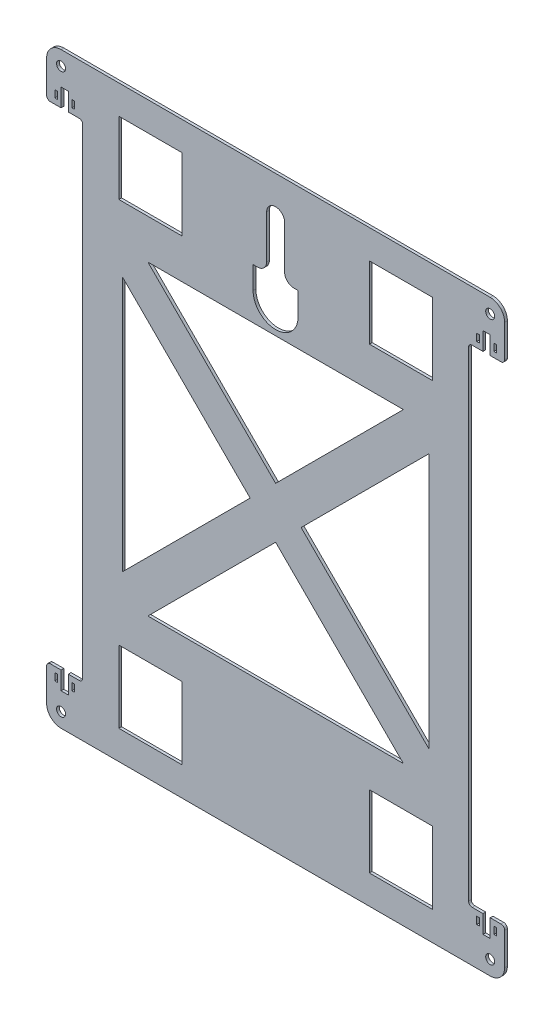
from build123d import *

# Parameters (mm, degrees)
SKETCH1_W          = 254
SKETCH1_H          = 326
BASE_FLANGE1_DEPTH = 1.51892
SKETCH6_R          = 2.5
SKETCH6_W          = 1.5
SKETCH6_H          = 4
SKETCH6_W_2        = 35
SKETCH6_H_2        = 40
CUT_EXTRUDE1_DEPTH = 10
CUT_EXTRUDE2_DEPTH = 10


# Sheet-metal steps are written as plain solids
with BuildPart() as part:
    # Sketch1 → Base-Flange1 (new body)
    with BuildSketch(Plane.XY):
        Rectangle(SKETCH1_W, SKETCH1_H)
    extrude(amount=BASE_FLANGE1_DEPTH)

    # Sketch6 → Cut-Extrude1 (cut)
    with BuildSketch(Plane(origin=(0, 0, 0), x_dir=(-1, 0, 0), z_dir=(0, 0, -1))):
        with BuildLine():
            ThreePointArc((-124.99999998, 135), (-126.414213542, 135.585786438), (-126.99999998, 137))
            Line((-127, 137), (-127, -137))
            ThreePointArc((-126.99999998, -137), (-126.414213542, -135.585786438), (-124.99999998, -135))
            Line((-124.99999998, -135), (-119, -135))
            Line((-119, -135), (-119, -145))
            Line((-119, -145), (-115, -145))
            Line((-115, -145), (-115, -135))
            Line((-115, -135), (-109, -135))
            ThreePointArc((-109, -135), (-107.585786438, -134.414213562), (-107, -133))
            Line((-107, -133), (-107, 133))
            ThreePointArc((-107, 133), (-107.585786438, 134.414213562), (-109, 135))
            Line((-109, 135), (-115, 135))
            Line((-115, 135), (-115, 145))
            Line((-115, 145), (-119, 145))
            Line((-119, 145), (-119, 135))
            Line((-119, 135), (-124.99999998, 135))
        make_face()
        with Locations((-119, 155)):
            Circle(SKETCH6_R)
        with BuildLine():
            ThreePointArc((-126.99999998, 155), (-124.656854247, 160.656854252), (-119, 163))
            Line((-119, 163), (-127, 163))
            Line((-127, 163), (-127, 155))
        make_face()
        with Locations((-121.75, 140)):
            Rectangle(SKETCH6_W, SKETCH6_H)
        with Locations((-112.25, 140)):
            Rectangle(SKETCH6_W, SKETCH6_H)
        with Locations((-69.5, 127)):
            Rectangle(SKETCH6_W_2, SKETCH6_H_2)
        with BuildLine():
            Line((127, -137), (127, 137))
            ThreePointArc((127, 137), (126.414213562, 135.585786438), (125, 135))
            Line((125, 135), (119, 135))
            Line((119, 135), (119, 145))
            Line((119, 145), (115, 145))
            Line((115, 145), (115, 135))
            Line((115, 135), (109, 135))
            ThreePointArc((109, 135), (107.585786438, 134.414213562), (107, 133))
            Line((107, 133), (107, -133))
            ThreePointArc((107, -133), (107.585786438, -134.414213562), (109, -135))
            Line((109, -135), (115, -135))
            Line((115, -135), (115, -145))
            Line((115, -145), (119, -145))
            Line((119, -145), (119, -135))
            Line((119, -135), (125, -135))
            ThreePointArc((125, -135), (126.414213562, -135.585786438), (127, -137))
        make_face()
        with Locations((121.75, 140)):
            Rectangle(SKETCH6_W, SKETCH6_H)
        with Locations((112.25, 140)):
            Rectangle(SKETCH6_W, SKETCH6_H)
        with Locations((119, 155)):
            Circle(SKETCH6_R)
        with Locations((69.5, 127)):
            Rectangle(SKETCH6_W_2, SKETCH6_H_2)
        with BuildLine():
            ThreePointArc((119, 163), (124.656854249, 160.656854249), (127, 155))
            Line((127, 155), (127, 163))
            Line((127, 163), (119, 163))
        make_face()
        with BuildLine():
            ThreePointArc((-10, 113), (-6.464466094, 114.464466094), (-5, 118))
            Line((-5, 118), (-5, 142))
            ThreePointArc((-5, 142), (0, 147), (5, 142))
            Line((5, 142), (5, 118))
            ThreePointArc((5, 118), (6.464466094, 114.464466094), (10, 113))
            Line((10, 113), (12.5, 113))
            Line((12.5, 113), (12.5, 100.5))
            ThreePointArc((12.5, 100.5), (0, 88), (-12.5, 100.5))
            Line((-12.5, 100.5), (-12.5, 113))
            Line((-12.5, 113), (-10, 113))
        make_face()
        with Locations((-69.5, -127)):
            Rectangle(SKETCH6_W_2, SKETCH6_H_2)
        with Locations((-119, -155)):
            Circle(SKETCH6_R)
        with BuildLine():
            Line((-127, -163), (-119, -163))
            ThreePointArc((-119, -163), (-124.656854232, -160.656854238), (-126.99999998, -155))
            Line((-127, -155), (-127, -163))
        make_face()
        with Locations((-121.75, -140)):
            Rectangle(SKETCH6_W, SKETCH6_H)
        with Locations((-112.25, -140)):
            Rectangle(SKETCH6_W, SKETCH6_H)
        with Locations((69.5, -127)):
            Rectangle(SKETCH6_W_2, SKETCH6_H_2)
        with Locations((112.25, -140)):
            Rectangle(SKETCH6_W, SKETCH6_H)
        with Locations((121.75, -140)):
            Rectangle(SKETCH6_W, SKETCH6_H)
        with Locations((119, -155)):
            Circle(SKETCH6_R)
        with BuildLine():
            Line((127, -163), (127, -155))
            ThreePointArc((127, -155), (124.656854249, -160.656854249), (119, -163))
            Line((119, -163), (127, -163))
        make_face()
    extrude(amount=-CUT_EXTRUDE1_DEPTH, mode=Mode.SUBTRACT)

    # Sketch7 → Cut-Extrude2 (cut)
    with BuildSketch(Plane(origin=(0, 0, 0), x_dir=(-1, 0, 0), z_dir=(0, 0, -1))):
        Polygon((85, -70.857864376), (85, 70.857864376), (14.142135624, 0), align=None)
        Polygon((0, 14.142135624), (70.857864376, 85), (-70.857864376, 85), align=None)
        Polygon((-85, -70.857864376), (-14.142135624, 0), (-85, 70.857864376), align=None)
        Polygon((70.857864376, -85), (0, -14.142135624), (-70.857864376, -85), align=None)
    extrude(amount=-CUT_EXTRUDE2_DEPTH, mode=Mode.SUBTRACT)


solid = part.part
